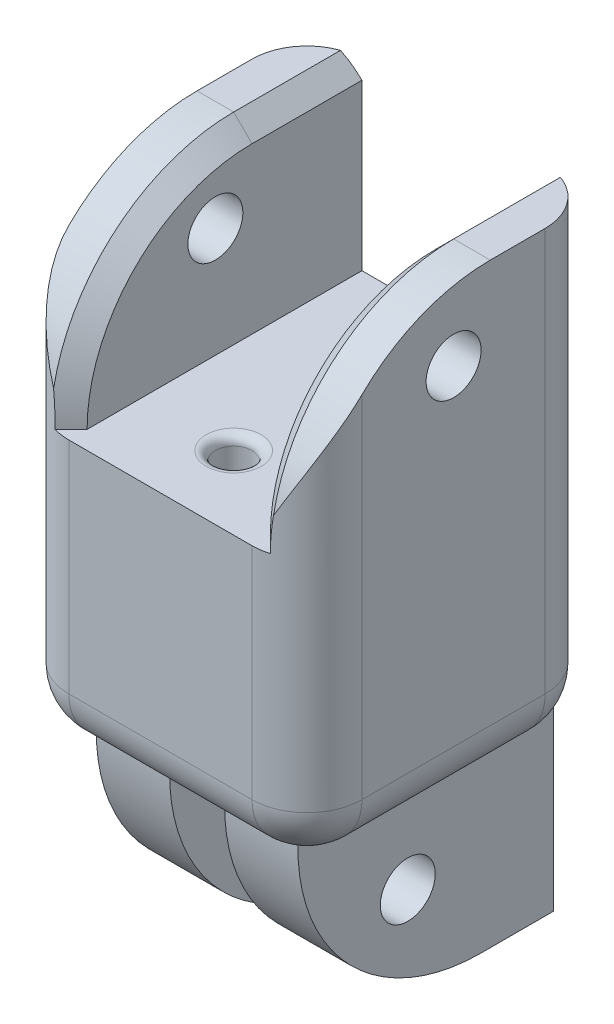
from build123d import *

# Parameters (mm, degrees)
BOSS_EXTRUDE1_DEPTH     = 16
CUT_EXTRUDE1_DEPTH      = 41.782962129
CUT_EXTRUDE1_DEPTH_BACK = 41.782962129
SKETCH2_R               = 1.5
FILLET1_DEPTH           = 35
SKETCH3_R               = 1
CUT_EXTRUDE2_DEPTH      = 33.607514639
CONG_2_R                = 3
CHAMFER3_SIZE           = 1
CONG_1_R                = 0.5


with BuildPart() as part:
    # Sketch1 → Boss-Extrude1 (new body)
    with BuildSketch(Plane.XY):
        Polygon((0, 0), (0, 10), (-2.5, 10), (-2.5, 35), (0.5, 35), (0.5, 25), (10.5, 25), (10.5, 35), (13.5, 35), (13.5, 10), (11, 10), (11, 0), (7, 0), (7, 10), (4, 10), (4, 0), align=None)
    extrude(amount=BOSS_EXTRUDE1_DEPTH)

    # Sketch2 → Cut-Extrude1 (cut, two sides: drawn at the far end of the back side and taken through both)
    with BuildSketch(Plane(origin=(11, 0, 0), x_dir=(0, 0, -1), z_dir=(1, 0, 0)).offset(-CUT_EXTRUDE1_DEPTH_BACK)):
        with BuildLine():
            Line((-16, 0), (-4, 0))
            ThreePointArc((-4, 0), (-11.071067812, 2.928932188), (-14, 10))
            Line((-14, 10), (-16, 10))
            Line((-16, 10), (-16, 0))
        make_face()
        with BuildLine():
            Line((-16, 35), (-16, 25))
            ThreePointArc((-16, 25), (-13.071067812, 32.071067812), (-6, 35))
            Line((-6, 35), (-16, 35))
        make_face()
        with Locations((-8, 5)):
            Circle(SKETCH2_R)
        with Locations(Location((-8, 31, 0), (0, 0, 90))):
            Circle(SKETCH2_R)
    extrude(amount=CUT_EXTRUDE1_DEPTH + CUT_EXTRUDE1_DEPTH_BACK, mode=Mode.SUBTRACT)

    # Fillet1: read off the stored shape, not the designer's step
    # Fillet1 outline → Fillet1 (cut)
    with BuildSketch(Plane(origin=(0, 0, 0), x_dir=(1, 0, 0), z_dir=(0, 1, 0))):
        with BuildLine():
            Line((13.5, 0), (10.5, 0))
            ThreePointArc((10.5, 0), (12.621320344, -0.878679656), (13.5, -3))
            Line((13.5, -3), (13.5, 0))
        make_face()
        with BuildLine():
            ThreePointArc((-2.5, -3), (-1.621320344, -0.878679656), (0.5, 0))
            Line((0.5, 0), (-2.5, 0))
            Line((-2.5, 0), (-2.5, -3))
        make_face()
        with BuildLine():
            Line((13.5, -16), (13.5, -13))
            ThreePointArc((13.5, -13), (12.621320344, -15.121320344), (10.5, -16))
            Line((10.5, -16), (13.5, -16))
        make_face()
        with BuildLine():
            ThreePointArc((0.5, -16), (-1.621320344, -15.121320344), (-2.5, -13))
            Line((-2.5, -13), (-2.5, -16))
            Line((-2.5, -16), (0.5, -16))
        make_face()
    extrude(amount=FILLET1_DEPTH, mode=Mode.SUBTRACT)

    # Sketch3 → Cut-Extrude2 (cut, through all)
    with BuildSketch(Plane.XZ.offset(-10)):
        with Locations(Location((5.5, 12, 0), (0, 0, 270))):
            Circle(SKETCH3_R)
        with Locations(Location((5.5, 4, 0), (0, 0, 270))):
            Circle(SKETCH3_R)
    extrude(amount=-CUT_EXTRUDE2_DEPTH, mode=Mode.SUBTRACT)

    # Congé2
    # the kernel refuses this fillet: 3 mm, written as the material it takes off along each edge
    with BuildSketch(Plane(origin=(10.5, 10, 16), x_dir=(0, 0, -1), z_dir=(-1, 0, 0))) as cong_2_piece_1_section:
        with BuildLine():
            CenterArc((CONG_2_R, -CONG_2_R), CONG_2_R, 90, 90)
            Line((0, -CONG_2_R), (0, 0))
            Line((0, 0), (CONG_2_R, 0))
        make_face()
    cong_2_piece_1 = extrude(amount=10, mode=Mode.PRIVATE)
    cong_2_piece_1 = cong_2_piece_1 - Plane(origin=(10.5, 10, 4), x_dir=(0, -1, 0), z_dir=(-1, 0, 0)) * Cylinder(10, 32, mode=Mode.PRIVATE)
    cong_2_piece_1 = split(cong_2_piece_1, bisect_by=Plane(origin=(7, 10, 16), z_dir=(1, 0, 0)), keep=Keep.TOP, mode=Mode.PRIVATE)
    add(cong_2_piece_1, mode=Mode.SUBTRACT)
    with BuildSketch(Plane(origin=(10.5, 10, 16), x_dir=(0, 0, -1), z_dir=(-1, 0, 0))) as cong_2_piece_2_section:
        with BuildLine():
            CenterArc((CONG_2_R, -CONG_2_R), CONG_2_R, 90, 90)
            Line((0, -CONG_2_R), (0, 0))
            Line((0, 0), (CONG_2_R, 0))
        make_face()
    cong_2_piece_2 = extrude(amount=10, mode=Mode.PRIVATE)
    cong_2_piece_2 = cong_2_piece_2 & Plane(origin=(10.5, 10, 4), x_dir=(0, -1, 0), z_dir=(-1, 0, 0)) * Cylinder(10, 32, mode=Mode.PRIVATE)
    cong_2_piece_2 = split(cong_2_piece_2, bisect_by=Plane(origin=(4, 10, 16), z_dir=(1, 0, 0)), keep=Keep.TOP, mode=Mode.PRIVATE)
    cong_2_piece_2 = split(cong_2_piece_2, bisect_by=Plane(origin=(7, 10, 16), z_dir=(-1, 0, 0)), keep=Keep.TOP, mode=Mode.PRIVATE)
    add(cong_2_piece_2, mode=Mode.SUBTRACT)
    with BuildSketch(Plane(origin=(10.5, 10, 16), x_dir=(0, 0, -1), z_dir=(-1, 0, 0))) as cong_2_piece_3_section:
        with BuildLine():
            CenterArc((CONG_2_R, -CONG_2_R), CONG_2_R, 90, 90)
            Line((0, -CONG_2_R), (0, 0))
            Line((0, 0), (CONG_2_R, 0))
        make_face()
    cong_2_piece_3 = extrude(amount=10, mode=Mode.PRIVATE)
    cong_2_piece_3 = cong_2_piece_3 - Plane(origin=(10.5, 10, 4), x_dir=(0, -1, 0), z_dir=(-1, 0, 0)) * Cylinder(10, 32, mode=Mode.PRIVATE)
    cong_2_piece_3 = split(cong_2_piece_3, bisect_by=Plane(origin=(4, 10, 16), z_dir=(1, 0, 0)), keep=Keep.TOP, mode=Mode.PRIVATE)
    cong_2_piece_3 = split(cong_2_piece_3, bisect_by=Plane(origin=(7, 10, 16), z_dir=(-1, 0, 0)), keep=Keep.TOP, mode=Mode.PRIVATE)
    add(cong_2_piece_3, mode=Mode.SUBTRACT)
    with BuildSketch(Plane(origin=(10.5, 10, 16), x_dir=(0, 0, -1), z_dir=(-1, 0, 0))) as cong_2_piece_4_section:
        with BuildLine():
            CenterArc((CONG_2_R, -CONG_2_R), CONG_2_R, 90, 90)
            Line((0, -CONG_2_R), (0, 0))
            Line((0, 0), (CONG_2_R, 0))
        make_face()
    cong_2_piece_4 = extrude(amount=10, mode=Mode.PRIVATE)
    cong_2_piece_4 = cong_2_piece_4 - Plane(origin=(10.5, 10, 4), x_dir=(0, -1, 0), z_dir=(-1, 0, 0)) * Cylinder(10, 32, mode=Mode.PRIVATE)
    cong_2_piece_4 = split(cong_2_piece_4, bisect_by=Plane(origin=(4, 10, 16), z_dir=(-1, 0, 0)), keep=Keep.TOP, mode=Mode.PRIVATE)
    add(cong_2_piece_4, mode=Mode.SUBTRACT)
    with BuildSketch(Plane(origin=(0.499999998, 10, 2.999999998), x_dir=(-1.0, 0, 5.011576341616869e-10), z_dir=(5.011576341616869e-10, 0, 1.0))) as cong_2_piece_5_section:
        with BuildLine():
            CenterArc((2.999999998 - CONG_2_R, -CONG_2_R), CONG_2_R, 0, 89.999999971)
            Line((2.999999998 - CONG_2_R, 0), (2.999999998, 0))
            Line((2.999999998, 0), (2.999999998, -CONG_2_R))
        make_face()
    cong_2_piece_5 = revolve(axis=Axis((0.499999998, 10, 2.999999998), (0, -1, 0)), revolution_arc=223.691304691, mode=Mode.PRIVATE)
    cong_2_piece_5 = split(cong_2_piece_5, bisect_by=Plane(origin=(0, 10, 2.999999998), z_dir=(-1, 0, 0)), keep=Keep.TOP, mode=Mode.PRIVATE)
    add(cong_2_piece_5, mode=Mode.SUBTRACT)
    with BuildSketch(Plane(origin=(10.500000002, 10, 2.999999998), x_dir=(-0.7230719874734535, 0, 0.6907726839787384), z_dir=(0.6907726839787384, 0, 0.7230719874734535))) as cong_2_piece_6_section:
        with BuildLine():
            CenterArc((2.999999998 - CONG_2_R, -CONG_2_R), CONG_2_R, 0, 89.999999971)
            Line((2.999999998, -CONG_2_R), (2.999999998, 0))
            Line((2.999999998, 0), (2.999999998 - CONG_2_R, 0))
        make_face()
    cong_2_piece_6 = revolve(axis=Axis((10.500000002, 10, 2.999999998), (0, -1, 0)), revolution_arc=223.691304691, mode=Mode.PRIVATE)
    cong_2_piece_6 = split(cong_2_piece_6, bisect_by=Plane(origin=(11, 10, 2.999999998), z_dir=(1, 0, 0)), keep=Keep.TOP, mode=Mode.PRIVATE)
    add(cong_2_piece_6, mode=Mode.SUBTRACT)
    with BuildSketch(Plane(origin=(13.5, 10, 3), x_dir=(-1, 0, 0), z_dir=(0, 0, 1))) as cong_2_piece_7_section:
        with BuildLine():
            CenterArc((CONG_2_R, -CONG_2_R), CONG_2_R, 90, 90)
            Line((0, -CONG_2_R), (0, 0))
            Line((0, 0), (CONG_2_R, 0))
        make_face()
    cong_2_piece_7 = extrude(amount=10, mode=Mode.PRIVATE)
    cong_2_piece_7 = split(cong_2_piece_7, bisect_by=Plane(origin=(11, 10, 3), z_dir=(1, 0, 0)), keep=Keep.TOP, mode=Mode.PRIVATE)
    add(cong_2_piece_7, mode=Mode.SUBTRACT)
    with BuildSketch(Plane(origin=(10.500000002, 10, 13.000000002), x_dir=(1.0, 0, -5.011588183995811e-10), z_dir=(-5.011588183995811e-10, 0, -1.0))) as cong_2_piece_8_section:
        with BuildLine():
            CenterArc((2.999999998 - CONG_2_R, -CONG_2_R), CONG_2_R, 0, 89.999999971)
            Line((2.999999998, -CONG_2_R), (2.999999998, 0))
            Line((2.999999998, 0), (2.999999998 - CONG_2_R, 0))
        make_face()
    cong_2_piece_8 = revolve(axis=Axis((10.500000002, 10, 13.000000002), (0, -1, 0)), revolution_arc=90.000000057, mode=Mode.PRIVATE)
    cong_2_piece_8 = cong_2_piece_8 & Plane(origin=(10.500000002, 10, 4), x_dir=(0, -1, 0), z_dir=(-1, 0, 0)) * Cylinder(10, 12, mode=Mode.PRIVATE)
    cong_2_piece_8 = split(cong_2_piece_8, bisect_by=Plane(origin=(11, 10, 13.000000002), z_dir=(1, 0, 0)), keep=Keep.TOP, mode=Mode.PRIVATE)
    add(cong_2_piece_8, mode=Mode.SUBTRACT)
    with BuildSketch(Plane(origin=(10.500000002, 10, 13.000000002), x_dir=(1.0, 0, -5.011588183995811e-10), z_dir=(-5.011588183995811e-10, 0, -1.0))) as cong_2_piece_9_section:
        with BuildLine():
            CenterArc((2.999999998 - CONG_2_R, -CONG_2_R), CONG_2_R, 0, 89.999999971)
            Line((2.999999998, -CONG_2_R), (2.999999998, 0))
            Line((2.999999998, 0), (2.999999998 - CONG_2_R, 0))
        make_face()
    cong_2_piece_9 = revolve(axis=Axis((10.500000002, 10, 13.000000002), (0, -1, 0)), revolution_arc=90.000000057, mode=Mode.PRIVATE)
    cong_2_piece_9 = cong_2_piece_9 - Plane(origin=(10.500000002, 10, 4), x_dir=(0, -1, 0), z_dir=(-1, 0, 0)) * Cylinder(10, 12, mode=Mode.PRIVATE)
    cong_2_piece_9 = split(cong_2_piece_9, bisect_by=Plane(origin=(11, 10, 13.000000002), z_dir=(-1, 0, 0)), keep=Keep.TOP, mode=Mode.PRIVATE)
    add(cong_2_piece_9, mode=Mode.SUBTRACT)
    with BuildSketch(Plane(origin=(10.500000002, 10, 13.000000002), x_dir=(1.0, 0, -5.011588183995811e-10), z_dir=(-5.011588183995811e-10, 0, -1.0))) as cong_2_piece_10_section:
        with BuildLine():
            CenterArc((2.999999998 - CONG_2_R, -CONG_2_R), CONG_2_R, 0, 89.999999971)
            Line((2.999999998, -CONG_2_R), (2.999999998, 0))
            Line((2.999999998, 0), (2.999999998 - CONG_2_R, 0))
        make_face()
    cong_2_piece_10 = revolve(axis=Axis((10.500000002, 10, 13.000000002), (0, -1, 0)), revolution_arc=90.000000057, mode=Mode.PRIVATE)
    cong_2_piece_10 = cong_2_piece_10 - Plane(origin=(10.500000002, 10, 4), x_dir=(0, -1, 0), z_dir=(-1, 0, 0)) * Cylinder(10, 12, mode=Mode.PRIVATE)
    cong_2_piece_10 = split(cong_2_piece_10, bisect_by=Plane(origin=(11, 10, 13.000000002), z_dir=(1, 0, 0)), keep=Keep.TOP, mode=Mode.PRIVATE)
    add(cong_2_piece_10, mode=Mode.SUBTRACT)
    with BuildSketch(Plane(origin=(-2.5, 10, 13), x_dir=(1, 0, 0), z_dir=(0, 0, -1))) as cong_2_piece_11_section:
        with BuildLine():
            CenterArc((CONG_2_R, -CONG_2_R), CONG_2_R, 90, 90)
            Line((0, -CONG_2_R), (0, 0))
            Line((0, 0), (CONG_2_R, 0))
        make_face()
    cong_2_piece_11 = extrude(amount=10, mode=Mode.PRIVATE)
    cong_2_piece_11 = split(cong_2_piece_11, bisect_by=Plane(origin=(0, 10, 13), z_dir=(-1, 0, 0)), keep=Keep.TOP, mode=Mode.PRIVATE)
    add(cong_2_piece_11, mode=Mode.SUBTRACT)
    with BuildSketch(Plane(origin=(0.499999998, 10, 13.000000002), x_dir=(5.011584483252393e-10, 0, 1.0), z_dir=(1.0, 0, -5.011584483252393e-10))) as cong_2_piece_12_section:
        with BuildLine():
            CenterArc((2.999999998 - CONG_2_R, -CONG_2_R), CONG_2_R, 0, 89.999999971)
            Line((2.999999998, -CONG_2_R), (2.999999998, 0))
            Line((2.999999998, 0), (2.999999998 - CONG_2_R, 0))
        make_face()
    cong_2_piece_12 = revolve(axis=Axis((0.499999998, 10, 13.000000002), (0, -1, 0)), revolution_arc=90.000000057, mode=Mode.PRIVATE)
    cong_2_piece_12 = split(cong_2_piece_12, bisect_by=Plane(origin=(0, 10, 13.000000002), z_dir=(1, 0, 0)), keep=Keep.TOP, mode=Mode.PRIVATE)
    cong_2_piece_12 = cong_2_piece_12 - Plane(origin=(0.499999998, 10, 4), x_dir=(0, -1, 0), z_dir=(-1, 0, 0)) * Cylinder(10, 12, mode=Mode.PRIVATE)
    add(cong_2_piece_12, mode=Mode.SUBTRACT)
    with BuildSketch(Plane(origin=(0.499999998, 10, 13.000000002), x_dir=(5.011584483252393e-10, 0, 1.0), z_dir=(1.0, 0, -5.011584483252393e-10))) as cong_2_piece_13_section:
        with BuildLine():
            CenterArc((2.999999998 - CONG_2_R, -CONG_2_R), CONG_2_R, 0, 89.999999971)
            Line((2.999999998, -CONG_2_R), (2.999999998, 0))
            Line((2.999999998, 0), (2.999999998 - CONG_2_R, 0))
        make_face()
    cong_2_piece_13 = revolve(axis=Axis((0.499999998, 10, 13.000000002), (0, -1, 0)), revolution_arc=90.000000057, mode=Mode.PRIVATE)
    cong_2_piece_13 = split(cong_2_piece_13, bisect_by=Plane(origin=(0, 10, 13.000000002), z_dir=(-1, 0, 0)), keep=Keep.TOP, mode=Mode.PRIVATE)
    cong_2_piece_13 = cong_2_piece_13 & Plane(origin=(0.499999998, 10, 4), x_dir=(0, -1, 0), z_dir=(-1, 0, 0)) * Cylinder(10, 12, mode=Mode.PRIVATE)
    add(cong_2_piece_13, mode=Mode.SUBTRACT)
    with BuildSketch(Plane(origin=(0.499999998, 10, 13.000000002), x_dir=(5.011584483252393e-10, 0, 1.0), z_dir=(1.0, 0, -5.011584483252393e-10))) as cong_2_piece_14_section:
        with BuildLine():
            CenterArc((2.999999998 - CONG_2_R, -CONG_2_R), CONG_2_R, 0, 89.999999971)
            Line((2.999999998, -CONG_2_R), (2.999999998, 0))
            Line((2.999999998, 0), (2.999999998 - CONG_2_R, 0))
        make_face()
    cong_2_piece_14 = revolve(axis=Axis((0.499999998, 10, 13.000000002), (0, -1, 0)), revolution_arc=90.000000057, mode=Mode.PRIVATE)
    cong_2_piece_14 = split(cong_2_piece_14, bisect_by=Plane(origin=(0, 10, 13.000000002), z_dir=(-1, 0, 0)), keep=Keep.TOP, mode=Mode.PRIVATE)
    cong_2_piece_14 = cong_2_piece_14 - Plane(origin=(0.499999998, 10, 4), x_dir=(0, -1, 0), z_dir=(-1, 0, 0)) * Cylinder(10, 12, mode=Mode.PRIVATE)
    add(cong_2_piece_14, mode=Mode.SUBTRACT)

    # Chamfer3
    # the kernel refuses this chamfer: 1 mm, written as the material it takes off along each edge
    with BuildSketch(Plane(origin=(10.5, 35, -2.571682988), x_dir=(0, -1, 0), z_dir=(0, 0, 1)), Plane(origin=(0.5, 35, -2.571682988), x_dir=(-1, 0, 0), z_dir=(0, 0, 1))) as chamfer3_piece_1:
        Polygon((CHAMFER3_SIZE, 0), (0, CHAMFER3_SIZE), (0, 0), align=None)
    extrude(amount=8.571682988, mode=Mode.SUBTRACT)
    with BuildSketch(Plane(origin=(10.5, 25, 6), x_dir=(0, 0, 1), z_dir=(0, -1, 0))) as chamfer3_piece_2:
        Polygon((10 - CHAMFER3_SIZE, 0), (10, -CHAMFER3_SIZE), (10, 0), align=None)
    revolve(axis=Axis((10.5, 25, 6), (-1, 0, 0)), revolution_arc=90, mode=Mode.SUBTRACT)
    with BuildSketch(Plane(origin=(0.5, 25, 6), x_dir=(0, 0, 1), z_dir=(0, -1, 0))) as chamfer3_piece_3:
        Polygon((10, CHAMFER3_SIZE), (10 - CHAMFER3_SIZE, 0), (10, 0), align=None)
    revolve(axis=Axis((0.5, 25, 6), (-1, 0, 0)), revolution_arc=90, mode=Mode.SUBTRACT)

    # Congé1
    cong_1_edges = [part.edges().sort_by_distance(p)[0] for p in [
        (5.5, 25, 13),
        (4.5, 10, 12),
        (5.5, 25, 5),
        (5.5, 10, 5),
    ]]
    fillet(cong_1_edges, radius=CONG_1_R - 0.0001)  # a hair under: the kernel refuses the full size


solid = part.part
